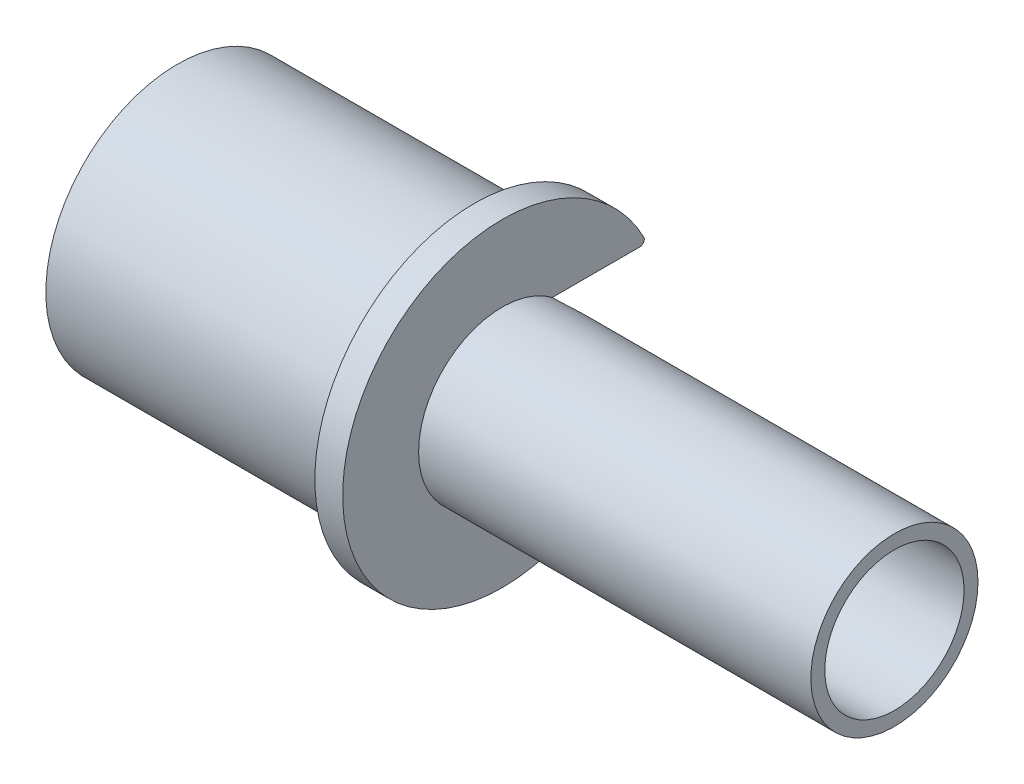
from build123d import *

# Parameters (mm, degrees)
CUT_EXTRUDE2_REACH = 46.224
FILLET1_R          = 0.254


with BuildPart() as part:
    # Sketch1 → Revolve1 (revolve)
    with BuildSketch(Plane.XY):
        Polygon((-1.4625, 3.96875), (-1.4625, 4.7625), (-23.8125, 4.7625), (-23.8125, 9.087499986), (-25.4, 9.087499986), (-25.4, 7.499999986), (-42.314999952, 7.499999986), (-42.314999952, 3.96875), align=None)
    revolve(axis=Axis((0, 0, 0), (-1, 0, 0)))

    # Sketch3 → Cut-Extrude2 (cut, up to next)
    with BuildSketch(Plane.XY, mode=Mode.PRIVATE) as cut_extrude2_sk1:
        with BuildLine():
            Line((-42.314999952, 3.81), (-42.314999952, -3.81))
            Line((-42.314999952, -3.81), (-23.8125, -3.81))
            ThreePointArc((-23.8125, -3.81), (-21.56743597, -2.88006403), (-20.6375, -0.635))
            Line((-20.6375, -0.635), (-20.6375, 0.635))
            ThreePointArc((-20.6375, 0.635), (-21.56743597, 2.88006403), (-23.8125, 3.81))
            Line((-23.8125, 3.81), (-42.314999952, 3.81))
        make_face()
    cut_extrude2_tool1 = extrude(cut_extrude2_sk1.sketch, amount=-CUT_EXTRUDE2_REACH, mode=Mode.PRIVATE) & part.part
    add(cut_extrude2_tool1.solids().sort_by_distance((-31.748711, 0, 0))[0], mode=Mode.SUBTRACT)

    # Fillet1
    fillet1_edges = [part.edges().sort_by_distance(p)[0] for p in [
        (-24.60625, 3.81, -8.250245814),
        (-24.60625, -3.81, -8.250245814),
        (-33.857499976, -3.81, -6.460178),
        (-33.857499976, 3.81, -6.460178),
    ]]
    fillet(fillet1_edges, radius=FILLET1_R)


solid = part.part
